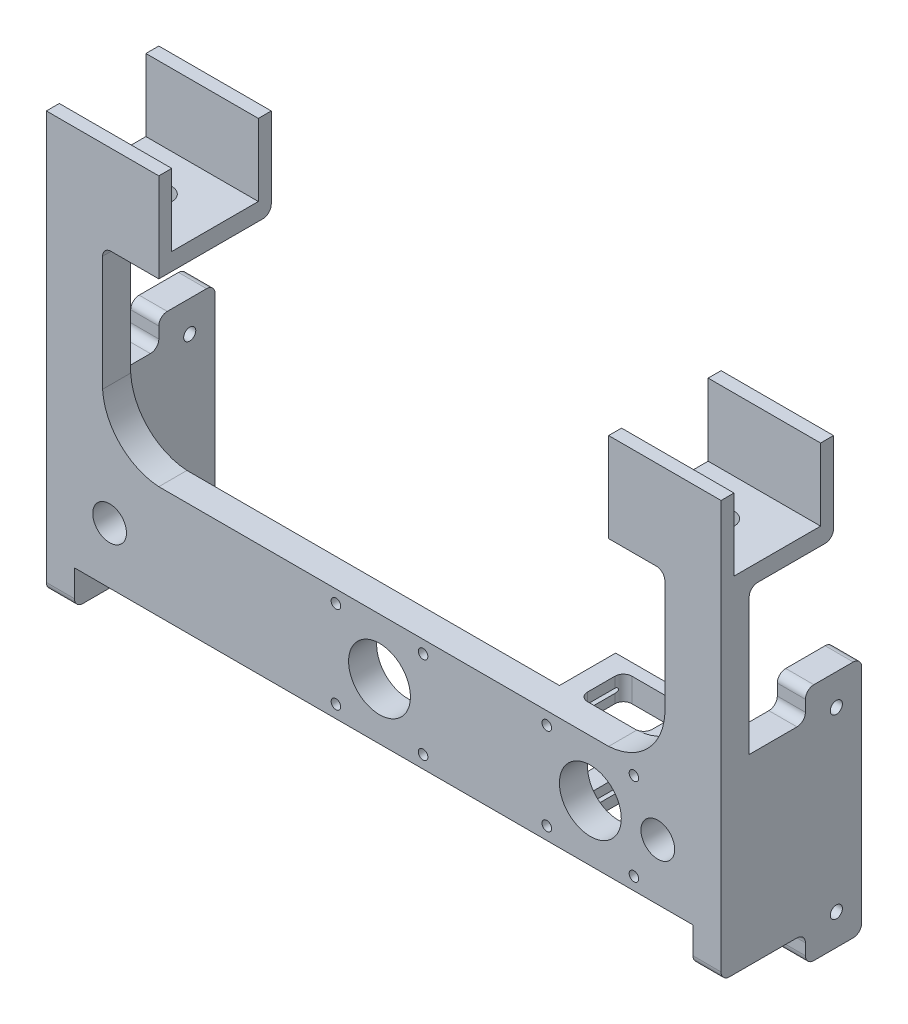
from build123d import *
from build123d.topology import SkipClean

# Parameters (mm, degrees)
SKETCH1_W            = 220
SKETCH1_H            = 40
SKETCH1_R            = 6
SKETCH1_R_2          = 1.7
SKETCH1_R_3          = 11
BOSS_EXTRUDE1_DEPTH  = 10
BOSS_EXTRUDE3_START  = -20
SKETCH3_R            = 9.05
SKETCH3_R_2          = 6
BOSS_EXTRUDE3_DEPTH  = 20
SKETCH4_W            = 50
SKETCH4_H            = 65
BOSS_EXTRUDE4_DEPTH  = 10
SKETCH5_W            = 57.5
SKETCH5_H            = 8.5
BOSS_EXTRUDE5_DEPTH  = 20
CUT_EXTRUDE3_START   = -40
SKETCH7_W            = 23
SKETCH7_H            = 15.765385727
CUT_EXTRUDE3_DEPTH   = 40
SKETCH11_W           = 10
SKETCH11_H           = 20
BOSS_EXTRUDE6_DEPTH  = 10
SKETCH12_W           = 10
SKETCH12_H           = 20
BOSS_EXTRUDE7_DEPTH  = 10
FILLET2_R            = 3
FILLET3_R            = 10
BOSS_EXTRUDE8_START  = 10
BOSS_EXTRUDE8_DEPTH  = 10
SKETCH20_R           = 2.15
CUT_EXTRUDE11_DEPTH  = 277
SKETCH19_R           = 2.15
CUT_EXTRUDE12_DEPTH  = 270
BOSS_EXTRUDE9_DEPTH  = 10
SKETCH22_W           = 40
SKETCH22_H           = 40
BOSS_EXTRUDE10_DEPTH = 31.75
SKETCH23_W           = 30.8
SKETCH23_H           = 25.6
CUT_EXTRUDE13_DEPTH  = 263.144
SKETCH24_R           = 4.65
CUT_EXTRUDE14_DEPTH  = 48.144
FILLET4_R            = 3
SKETCH25_R           = 1.7
CUT_EXTRUDE16_DEPTH  = 60.144


with BuildPart() as part:
    # Sketch1 → Boss-Extrude1 (new body)
    with BuildSketch(Plane.XY):
        with Locations((1.5, 0)):
            Rectangle(SKETCH1_W, SKETCH1_H)
        with Locations((99, 0)):
            Circle(SKETCH1_R, mode=Mode.SUBTRACT)
        with Locations((-96, 0)):
            Circle(SKETCH1_R, mode=Mode.SUBTRACT)
        with Locations((-15.5, 15.5)):
            Circle(SKETCH1_R_2, mode=Mode.SUBTRACT)
        with Locations((15.5, 15.5)):
            Circle(SKETCH1_R_2, mode=Mode.SUBTRACT)
        Circle(SKETCH1_R_3, mode=Mode.SUBTRACT)
        with Locations((-15.5, -15.5)):
            Circle(SKETCH1_R_2, mode=Mode.SUBTRACT)
        with Locations((15.5, -15.5)):
            Circle(SKETCH1_R_2, mode=Mode.SUBTRACT)
        with Locations((75, 0)):
            Circle(SKETCH1_R_3, mode=Mode.SUBTRACT)
        with Locations((59.5, 15.5)):
            Circle(SKETCH1_R_2, mode=Mode.SUBTRACT)
        with Locations((59.5, -15.5)):
            Circle(SKETCH1_R_2, mode=Mode.SUBTRACT)
        with Locations((90.5, 15.5)):
            Circle(SKETCH1_R_2, mode=Mode.SUBTRACT)
        with Locations((90.5, -15.5)):
            Circle(SKETCH1_R_2, mode=Mode.SUBTRACT)
    extrude(amount=BOSS_EXTRUDE1_DEPTH)

    # Sketch3 → Boss-Extrude3 (add)
    # profile 1 of 2: a face of its own
    with BuildSketch(Plane.XY.offset(10).offset(BOSS_EXTRUDE3_START)):
        with Locations((-96, 0)):
            Circle(SKETCH3_R)
        with Locations((-96, 0)):
            Circle(SKETCH3_R_2, mode=Mode.SUBTRACT)
    # profile 2 of 2: a face of its own
    with BuildSketch(Plane.XY.offset(10).offset(BOSS_EXTRUDE3_START)):
        with Locations((99, 0)):
            Circle(SKETCH3_R)
        with Locations((99, 0)):
            Circle(SKETCH3_R_2, mode=Mode.SUBTRACT)
    extrude(amount=BOSS_EXTRUDE3_DEPTH)

    # Sketch4 → Boss-Extrude4 (add)
    with BuildSketch(Plane(origin=(111.5, 0, 0), x_dir=(0, 0, -1), z_dir=(1, 0, 0))):
        with Locations((15, 0)):
            Rectangle(SKETCH4_W, SKETCH4_H)
    extrude(amount=BOSS_EXTRUDE4_DEPTH)

    # Sketch5 → Boss-Extrude5 (add)
    with BuildSketch(Plane(origin=(0, 0, 0), x_dir=(-1, 0, 0), z_dir=(0, 0, -1))):
        with Locations((-82.75, 15.75)):
            Rectangle(SKETCH5_W, SKETCH5_H)
        with Locations((-82.75, -15.75)):
            Rectangle(SKETCH5_W, SKETCH5_H)
    extrude(amount=BOSS_EXTRUDE5_DEPTH)

    # Sketch7 → Cut-Extrude3 (cut)
    with BuildSketch(Plane(origin=(0, 20, 0), x_dir=(1, 0, 0), z_dir=(0, 1, 0)).offset(CUT_EXTRUDE3_START)):
        with Locations((72.5, 7.882692864)):
            Rectangle(SKETCH7_W, SKETCH7_H)
    extrude(amount=CUT_EXTRUDE3_DEPTH, mode=Mode.SUBTRACT)

    # Sketch11 → Boss-Extrude6 (add)
    with BuildSketch(Plane(origin=(0, 32.5, 0), x_dir=(1, 0, 0), z_dir=(0, 1, 0))):
        with Locations((116.5, 30)):
            Rectangle(SKETCH11_W, SKETCH11_H)
    extrude(amount=BOSS_EXTRUDE6_DEPTH)

    # Sketch12 → Boss-Extrude7 (add)
    with BuildSketch(Plane.XZ.offset(32.5)):
        with Locations((116.5, -30)):
            Rectangle(SKETCH12_W, SKETCH12_H)
    extrude(amount=BOSS_EXTRUDE7_DEPTH)

    # Fillet2
    # the kernel refuses this fillet: 3 mm, written as the material it adds along each edge
    with BuildSketch(Plane(origin=(121.5, -32.5, -20), x_dir=(0, 0, 1), z_dir=(-1, 0, 0))) as fillet2_piece_1:
        with BuildLine():
            CenterArc((FILLET2_R, -FILLET2_R), FILLET2_R, 90, 90)
            Line((0, -FILLET2_R), (0, 0))
            Line((0, 0), (FILLET2_R, 0))
        make_face()
    extrude(amount=10)
    with BuildSketch(Plane(origin=(111.5, 32.5, -20), x_dir=(0, 1, 0), z_dir=(1, 0, 0))) as fillet2_piece_2:
        with BuildLine():
            CenterArc((FILLET2_R, FILLET2_R), FILLET2_R, 180, 90)
            Line((0, FILLET2_R), (0, 0))
            Line((0, 0), (FILLET2_R, 0))
        make_face()
    extrude(amount=10)
    with BuildSketch(Plane(origin=(84, 11.5, -15.765385727), x_dir=(0, 0, 1), z_dir=(0, 1, 0)), Plane(origin=(61, 11.5, -15.765385727), x_dir=(1, 0, 0), z_dir=(0, 1, 0)), Plane(origin=(84, 11.5, 0), x_dir=(-1, 0, 0), z_dir=(0, 1, 0)), Plane(origin=(84, -20, 0), x_dir=(-1, 0, 0), z_dir=(0, 1, 0))) as fillet2_piece_3:
        with BuildLine():
            CenterArc((FILLET2_R, -FILLET2_R), FILLET2_R, 90, 90)
            Line((0, -FILLET2_R), (0, 0))
            Line((0, 0), (FILLET2_R, 0))
        make_face()
    extrude(amount=8.5)
    with BuildSketch(Plane(origin=(61, 11.5, 0), x_dir=(1, 0, 0), z_dir=(0, 1, 0))) as fillet2_piece_4_section:
        with BuildLine():
            CenterArc((FILLET2_R, FILLET2_R), FILLET2_R, 180, 90)
            Line((0, FILLET2_R), (0, 0))
            Line((0, 0), (FILLET2_R, 0))
        make_face()
    fillet2_piece_4 = extrude(amount=10.7, mode=Mode.PRIVATE)
    fillet2_piece_4 = fillet2_piece_4 - Plane(origin=(59.5, 15.5, -0.653390462), x_dir=(1, 0, 0), z_dir=(0, 0, -1)) * Cylinder(1.7, 34, mode=Mode.PRIVATE)
    fillet2_piece_4 = split(fillet2_piece_4, bisect_by=Plane(origin=(61.689155884, 20, -0.653390462), z_dir=(0, -1, 0)), keep=Keep.TOP, mode=Mode.PRIVATE)
    add(fillet2_piece_4)
    with BuildSketch(Plane(origin=(84, -20, -15.765385727), x_dir=(-1, 0, 0), z_dir=(0, 1, 0))) as fillet2_piece_5:
        with BuildLine():
            CenterArc((FILLET2_R, FILLET2_R), FILLET2_R, 180, 90)
            Line((0, FILLET2_R), (0, 0))
            Line((0, 0), (FILLET2_R, 0))
        make_face()
    extrude(amount=8.5)
    # the kernel refuses this fillet: 3 mm, written as the material it takes off along each edge
    with BuildSketch(Plane(origin=(104, -32.5, 10), x_dir=(0, 0, -1), z_dir=(1, 0, 0)), Plane(origin=(129, -42.5, -20), x_dir=(0, 1, 0), z_dir=(-1, 0, 0)), Plane(origin=(129, 42.5, -40), x_dir=(0, -1, 0), z_dir=(-1, 0, 0))) as fillet2_2_piece_1:
        with BuildLine():
            CenterArc((FILLET2_R, FILLET2_R), FILLET2_R, 180, 90)
            Line((0, FILLET2_R), (0, 0))
            Line((0, 0), (FILLET2_R, 0))
        make_face()
    extrude(amount=25, mode=Mode.SUBTRACT)
    with BuildSketch(Plane(origin=(104, -42.5, -40), x_dir=(0, 0, 1), z_dir=(1, 0, 0)), Plane(origin=(104, 32.5, 10), x_dir=(0, 0, -1), z_dir=(1, 0, 0)), Plane(origin=(104, 42.5, -20), x_dir=(0, 0, -1), z_dir=(1, 0, 0))) as fillet2_2_piece_2:
        with BuildLine():
            CenterArc((FILLET2_R, -FILLET2_R), FILLET2_R, 90, 90)
            Line((0, -FILLET2_R), (0, 0))
            Line((0, 0), (FILLET2_R, 0))
        make_face()
    extrude(amount=25, mode=Mode.SUBTRACT)

    # Fillet3
    fillet3_edges = [part.edges().sort_by_distance(p)[0] for p in [
        (111.5, 15.75, -20),
        (111.5, -15.75, -20),
    ]]
    fillet(fillet3_edges, radius=FILLET3_R)

    # Sketch13 → Boss-Extrude8 (add)
    with BuildSketch(Plane.ZY.offset(108.5).offset(BOSS_EXTRUDE8_START)):
        with BuildLine():
            Line((10, 29.5), (10, -29.5))
            ThreePointArc((10, -29.5), (9.121320344, -31.621320344), (7, -32.5))
            Line((7, -32.5), (-17, -32.5))
            ThreePointArc((-17, -32.5), (-19.121320344, -33.378679656), (-20, -35.5))
            Line((-20, -35.5), (-20, -39.5))
            ThreePointArc((-20, -39.5), (-20.878679656, -41.621320344), (-23, -42.5))
            Line((-23, -42.5), (-37, -42.5))
            ThreePointArc((-37, -42.5), (-39.121320344, -41.621320344), (-40, -39.5))
            Line((-40, -39.5), (-40, 39.5))
            ThreePointArc((-40, 39.5), (-39.121320344, 41.621320344), (-37, 42.5))
            Line((-37, 42.5), (-23, 42.5))
            ThreePointArc((-23, 42.5), (-20.878679656, 41.621320344), (-20, 39.5))
            Line((-20, 39.5), (-20, 35.5))
            ThreePointArc((-20, 35.5), (-19.121320344, 33.378679656), (-17, 32.5))
            Line((-17, 32.5), (7, 32.5))
            ThreePointArc((7, 32.5), (9.121320344, 31.621320344), (10, 29.5))
        make_face()
    extrude(amount=-BOSS_EXTRUDE8_DEPTH)

    # Sketch20 → Cut-Extrude11 (cut)
    with BuildSketch(Plane.ZY.offset(118.5)):
        with Locations((-31, 31.5)):
            Circle(SKETCH20_R)
    extrude(amount=-CUT_EXTRUDE11_DEPTH, mode=Mode.SUBTRACT)

    # Sketch19 → Cut-Extrude12 (cut)
    with BuildSketch(Plane.ZY.offset(118.5)):
        with Locations((-31, -31.5)):
            Circle(SKETCH19_R)
    extrude(amount=-CUT_EXTRUDE12_DEPTH, mode=Mode.SUBTRACT)

    # Sketch16 → Boss-Extrude9 (add)
    with BuildSketch(Plane.XY.offset(10)):
        with BuildLine():
            Line((-98.5, 84), (-118.5, 84))
            Line((-118.5, 84), (-118.5, 29.5))
            Line((-118.5, 29.5), (-108.5, 29.5))
            Line((-108.5, 29.5), (-108.5, 20))
            Line((-108.5, 20), (-78.5, 20))
            ThreePointArc((-78.5, 20), (-92.297269835, 26.202730165), (-98.5, 40))
            Line((-98.5, 40), (-98.5, 84))
        make_face()
    boss_extrude9 = extrude(amount=-BOSS_EXTRUDE9_DEPTH)

    # Mirror1: Boss-Extrude9 across plane
    add(boss_extrude9.mirror(Plane(origin=(1.5, 0, 0), x_dir=(0, 0, 1), z_dir=(1, 0, 0))))

    # Sketch22 → Boss-Extrude10 (add)
    with BuildSketch(Plane(origin=(0, 84, 0), x_dir=(1, 0, 0), z_dir=(0, 1, 0))):
        with Locations((101.5, 10)):
            Rectangle(SKETCH22_W, SKETCH22_H)
    boss_extrude10 = extrude(amount=BOSS_EXTRUDE10_DEPTH)

    # Mirror2: Boss-Extrude10 across plane
    add(boss_extrude10.mirror(Plane(origin=(1.5, 0, 0), x_dir=(0, 0, 1), z_dir=(1, 0, 0))))

    # Sketch23 → Cut-Extrude13 (cut)
    with BuildSketch(Plane.ZY.offset(118.5)):
        with Locations((-10, 102.95)):
            Rectangle(SKETCH23_W, SKETCH23_H)
    extrude(amount=-CUT_EXTRUDE13_DEPTH, mode=Mode.SUBTRACT)

    # Sketch24 → Cut-Extrude14 (cut)
    with BuildSketch(Plane.XZ.offset(-84)):
        with Locations((-98.5, -10)):
            Circle(SKETCH24_R)
        with Locations((101.5, -10)):
            Circle(SKETCH24_R)
    extrude(amount=-CUT_EXTRUDE14_DEPTH, mode=Mode.SUBTRACT)

    # Fillet4
    fillet4_edges = [part.edges().sort_by_distance(p)[0] for p in [
        (-98.5, 84, 5),
        (-108.5, 84, 0),
        (111.5, 84, 0),
        (101.5, 84, 5),
        (101.5, 84, -30),
        (-98.5, 84, -30),
    ]]
    fillet(fillet4_edges, radius=FILLET4_R)

    # Sketch25 → Cut-Extrude16 (cut)
    with SkipClean():  # the faces are left unmerged after this step: merging them gives an invalid solid
        with BuildSketch(Plane(origin=(0, 0, -20), x_dir=(-1, 0, 0), z_dir=(0, 0, -1))):
            with Locations((-90.5, 15.5)):
                Circle(SKETCH25_R)
            with Locations((-59.5, 15.5)):
                Circle(SKETCH25_R)
            with Locations((-90.5, -15.5)):
                Circle(SKETCH25_R)
            with Locations((-59.5, -15.5)):
                Circle(SKETCH25_R)
        extrude(amount=-CUT_EXTRUDE16_DEPTH, mode=Mode.SUBTRACT)


solid = part.part
